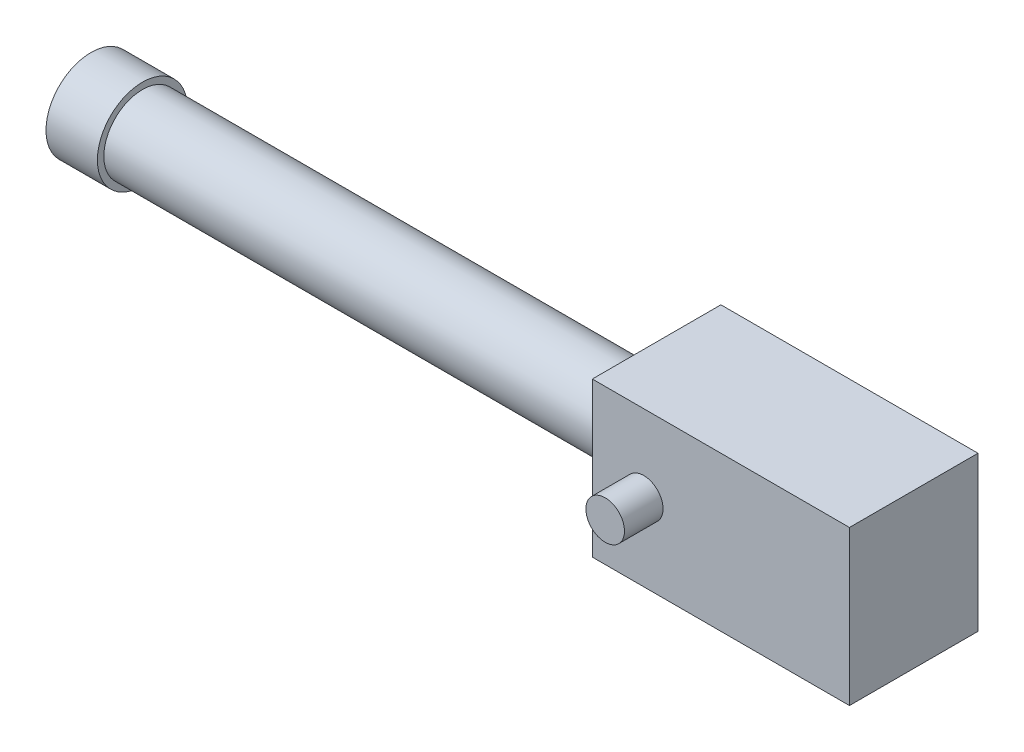
from build123d import *

# Parameters (mm, degrees)
SKETCH1_W           = 1000
SKETCH1_H           = 600
BOSS_EXTRUDE1_DEPTH = 500
SKETCH3_R           = 75
BOSS_EXTRUDE3_DEPTH = 150
BOSS_EXTRUDE4_START = 150
SKETCH4_R           = 75
BOSS_EXTRUDE4_DEPTH = 150
SKETCH5_R           = 150
BOSS_EXTRUDE5_DEPTH = 2000
SKETCH6_R           = 175
BOSS_EXTRUDE6_DEPTH = 200


with BuildPart() as part:
    # Sketch1 → Boss-Extrude1 (new body)
    with BuildSketch(Plane.XY):
        with Locations((179.422382671, -99.277978339)):
            Rectangle(SKETCH1_W, SKETCH1_H)
    extrude(amount=BOSS_EXTRUDE1_DEPTH)

    # Sketch3 → Boss-Extrude3 (add)
    with BuildSketch(Plane.XY.offset(500)):
        with Locations((-120.577617329, -99.277978339)):
            Circle(SKETCH3_R)
    extrude(amount=BOSS_EXTRUDE3_DEPTH)

    # Sketch4 → Boss-Extrude4 (add)
    with BuildSketch(Plane(origin=(0, 0, 0), x_dir=(-1, 0, 0), z_dir=(0, 0, -1)).offset(BOSS_EXTRUDE4_START)):
        with Locations((120.577617329, -99.277978339)):
            Circle(SKETCH4_R)
    extrude(amount=-BOSS_EXTRUDE4_DEPTH)

    # Sketch5 → Boss-Extrude5 (add)
    with BuildSketch(Plane.ZY.offset(320.577617329)):
        with Locations((250, -99.277978339)):
            Circle(SKETCH5_R)
    extrude(amount=BOSS_EXTRUDE5_DEPTH)

    # Sketch6 → Boss-Extrude6 (add)
    with BuildSketch(Plane.ZY.offset(2320.577617329)):
        with Locations((250, -99.277978339)):
            Circle(SKETCH6_R)
    extrude(amount=BOSS_EXTRUDE6_DEPTH)


solid = part.part
